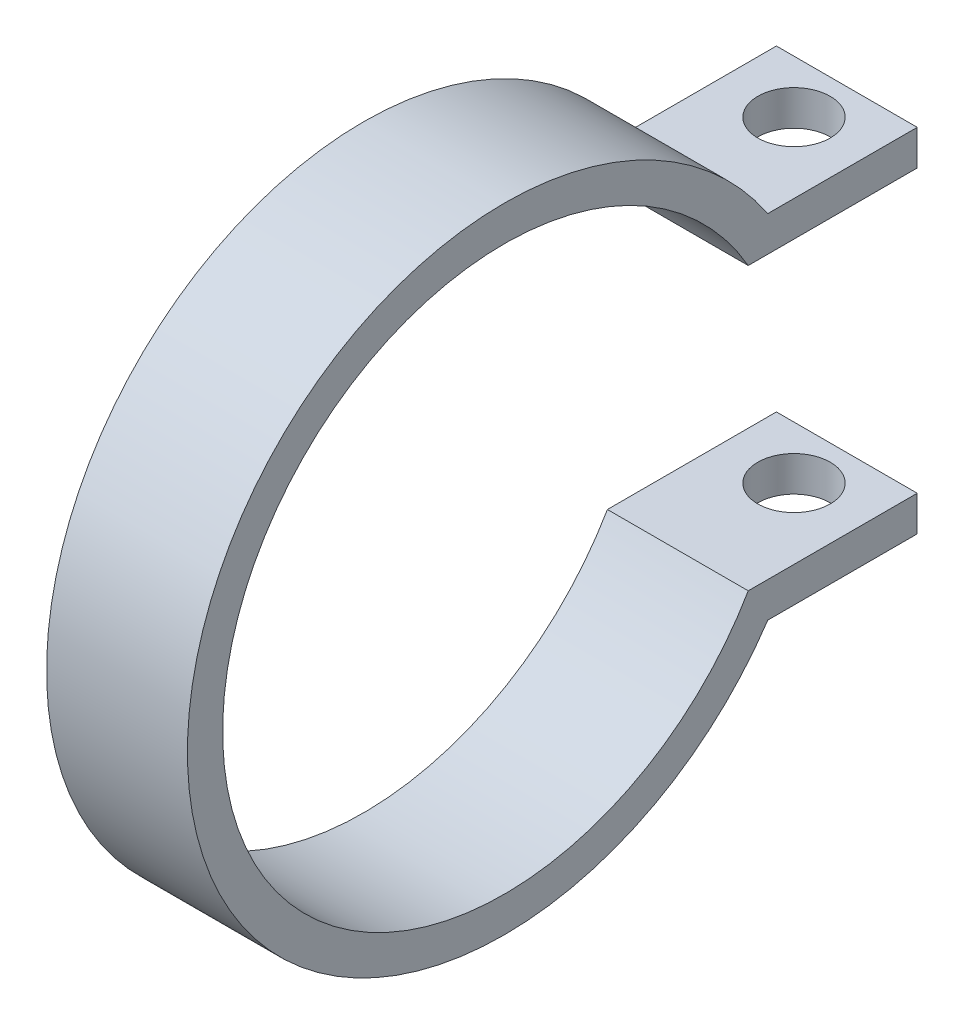
from build123d import *

# Parameters (mm, degrees)
BOSS_EXTRUDE1_DEPTH   = 6.35
F_4_CLEARANCE_HOLE1_D = 3.2639


with BuildPart() as part:
    # Sketch2 → Boss-Extrude1 (new body)
    with BuildSketch(Plane.YZ):
        with BuildLine():
            Line((-6.35, -10.998522628), (-6.35, -18.618522628))
            Line((-6.35, -18.618522628), (-7.9375, -18.618522628))
            Line((-7.9375, -18.618522628), (-7.9375, -11.879762203))
            ThreePointArc((-7.9375, -11.879762203), (0, 14.2875), (7.9375, -11.879762203))
            Line((7.9375, -11.879762203), (7.9375, -18.618522628))
            Line((7.9375, -18.618522628), (6.35, -18.618522628))
            Line((6.35, -18.618522628), (6.35, -10.998522628))
            ThreePointArc((6.35, -10.998522628), (0, 12.7), (-6.35, -10.998522628))
        make_face()
    extrude(amount=BOSS_EXTRUDE1_DEPTH)

    # #4 Clearance Hole1 (through all)
    with Locations(Plane.XZ.offset(7.9375)):
        with Locations((3.175, -16.237272628)):
            Hole(F_4_CLEARANCE_HOLE1_D / 2)


solid = part.part
